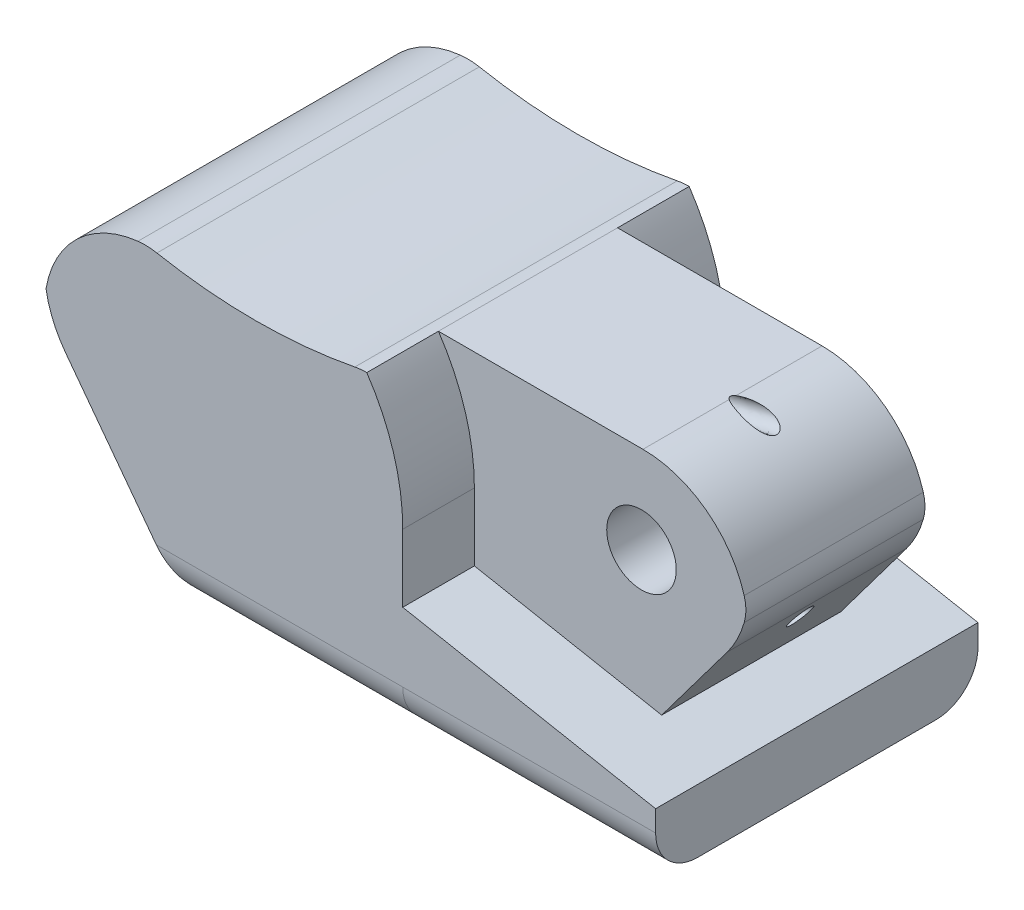
from build123d import *

# Parameters (mm, degrees)
BOSS_EXTRUDE1_DEPTH = 15.3
FILLET1_R           = 5
SKETCH3_R           = 1.6499999999999986
CUT_EXTRUDE1_DEPTH  = 27.1150700798197
SKETCH6_W           = 13.000000000000002
SKETCH6_H           = 3.3999999999999995
SKETCH6_H_2         = 3.4000000000000004
CUT_EXTRUDE4_DEPTH  = 12
CUT_EXTRUDE5_DEPTH  = 27.1150700798197
FILLET5_R           = 3
FILLET7_R           = 10
FILLET8_R           = 2
SKETCH14_W          = 39.168400235904954
SKETCH14_H          = 4.224796924987116
CUT_EXTRUDE8_DEPTH  = 27.115070253014974
FILLET10_R          = 2
BOSS_EXTRUDE2_START = -15.3
BOSS_EXTRUDE2_DEPTH = 15.3
FILLET11_R          = 2
FILLET15_R          = 2
SKETCH8_R           = 0.5000000000000026
CUT_EXTRUDE10_DEPTH = 38.472055021272986
SKETCH8_5_R         = 0.5000000000000026
CUT_EXTRUDE11_DEPTH = 37.89801687295938
SKETCH19_R          = 1.5000000000000007
CUT_EXTRUDE12_DEPTH = 4


with BuildPart() as part:
    # Sketch2 → Boss-Extrude1 (new body)
    with BuildSketch(Plane.XY):
        Polygon((-15, 0), (15, 0), (15, -5), (7.5, -15.000000000000002), (-7.5, -15.000000000000002), (-15, -5), align=None)
    extrude(amount=BOSS_EXTRUDE1_DEPTH)

    # Fillet1
    # the kernel refuses this fillet: 5 mm, written as the material it takes off along each edge
    with BuildSketch(Plane(origin=(15, 0, -12.499999999999998), x_dir=(-1, 0, 0), z_dir=(0, 0, 1))) as fillet1_piece_1:
        with BuildLine():
            CenterArc((FILLET1_R, FILLET1_R), FILLET1_R, 180, 90)
            Line((0, FILLET1_R), (0, 0))
            Line((0, 0), (FILLET1_R, 0))
        make_face()
    extrude(amount=40.3, mode=Mode.SUBTRACT)
    with BuildSketch(Plane(origin=(-15, 0, -12.499999999999998), x_dir=(1, 0, 0), z_dir=(0, 0, 1))) as fillet1_piece_2:
        with BuildLine():
            CenterArc((FILLET1_R, -FILLET1_R), FILLET1_R, 90, 90)
            Line((0, -FILLET1_R), (0, 0))
            Line((0, 0), (FILLET1_R, 0))
        make_face()
    extrude(amount=40.3, mode=Mode.SUBTRACT)
    with BuildSketch(Plane(origin=(15, -5, -4.166666666666666), x_dir=(0, 1, 0), z_dir=(0, 0, 1))) as fillet1_piece_3:
        with BuildLine():
            CenterArc((FILLET1_R * 0.333333333333, FILLET1_R), FILLET1_R, 233.13010235415598, 36.86989764584405)
            Line((-FILLET1_R * 0.266666666667, FILLET1_R * 0.2), (0, 0))
            Line((0, 0), (FILLET1_R * 0.333333333333, 0))
        make_face()
    extrude(amount=23.633333333333333, mode=Mode.SUBTRACT)
    with BuildSketch(Plane(origin=(7.5, -15.000000000000002, -6.250000000000007), x_dir=(0.6000000000000001, 0.7999999999999998, 0), z_dir=(0, 0, 1))) as fillet1_piece_4:
        with BuildLine():
            CenterArc((FILLET1_R * 0.5, FILLET1_R), FILLET1_R, 216.86989764584402, 53.13010235415601)
            Line((-FILLET1_R * 0.3, FILLET1_R * 0.4), (0, 0))
            Line((0, 0), (FILLET1_R * 0.5, 1.8e-16))
        make_face()
    extrude(amount=27.80000000000001, mode=Mode.SUBTRACT)
    with BuildSketch(Plane(origin=(-7.5, -15.000000000000002, -6.2500000000000036), x_dir=(1, 0, 0), z_dir=(0, 0, 1))) as fillet1_piece_5:
        with BuildLine():
            CenterArc((FILLET1_R * 0.5, FILLET1_R), FILLET1_R, 216.869897645844, 53.13010235415601)
            Line((-FILLET1_R * 0.3, FILLET1_R * 0.4), (0, 0))
            Line((0, 0), (FILLET1_R * 0.5, 0))
        make_face()
    extrude(amount=27.800000000000008, mode=Mode.SUBTRACT)
    with BuildSketch(Plane(origin=(-15, -5, -4.166666666666666), x_dir=(0.6000000000000004, -0.7999999999999998, 0), z_dir=(0, 0, 1))) as fillet1_piece_6:
        with BuildLine():
            CenterArc((FILLET1_R * 0.333333333333, FILLET1_R), FILLET1_R, 233.13010235415595, 36.86989764584399)
            Line((-FILLET1_R * 0.266666666667, FILLET1_R * 0.2), (0, 0))
            Line((0, 0), (FILLET1_R * 0.333333333333, -3e-17))
        make_face()
    extrude(amount=23.63333333333333, mode=Mode.SUBTRACT)

    # Sketch3 → Cut-Extrude1 (cut, through all)
    with BuildSketch(Plane.XY.offset(15.3)):
        with Locations((9.930066485916347, -4.166666666666668)):
            Circle(SKETCH3_R)
    extrude(amount=-CUT_EXTRUDE1_DEPTH, mode=Mode.SUBTRACT)

    # Sketch6 → Cut-Extrude4 (cut)
    with BuildSketch(Plane(origin=(0, 0, 0), x_dir=(1, 0, 0), z_dir=(0, 1, 0))):
        with Locations((8.5, -1.6999999999999997)):
            Rectangle(SKETCH6_W, SKETCH6_H)
        with Locations((8.5, -13.600000000000001)):
            Rectangle(SKETCH6_W, SKETCH6_H_2)
    extrude(amount=-CUT_EXTRUDE4_DEPTH, mode=Mode.SUBTRACT)

    # Sketch7 → Cut-Extrude5 (cut, through all)
    with BuildSketch(Plane(origin=(0, 0, 0), x_dir=(-1, 0, 0), z_dir=(0, 0, -1))):
        with BuildLine():
            Line((0, 0), (9.999999999999998, 0))
            ThreePointArc((9.999999999999998, 0), (5.000000000000001, -0.5051025721682194), (0, 0))
        make_face()
    extrude(amount=-CUT_EXTRUDE5_DEPTH, mode=Mode.SUBTRACT)

    # Fillet5
    fillet5_edges = [part.edges().sort_by_distance(p)[0] for p in [
        (0, 1.78e-15, 7.65),
        (-10, 0, 7.649999999999999),
    ]]
    fillet(fillet5_edges, radius=FILLET5_R)

    # Fillet7
    # the kernel refuses this fillet: 10 mm, written as the material it takes off along each edge
    with BuildSketch(Plane(origin=(2, 0, 29.264915023330374), x_dir=(-1.0, -2.233978436482516e-12, 0), z_dir=(0, 0, -1))) as fillet7_piece_1:
        with BuildLine():
            CenterArc((10.000000000012479, -5.585966009309811), FILLET7_R, 146.04120119417382, 33.95879880595419)
            Line((1.247893e-11, -5.58596600933215), (-0.19999999998752124, -5.585966009332597))
            Line((-0.19999999998752124, -5.585966009332597), (-0.20000000000000018, -4.468e-13))
            Line((-0.20000000000000018, -4.468e-13), (-4.468e-13, 0.2))
            ThreePointArc((-4.468e-13, 0.2), (0.852802640859637, 0.20000000000190515), (1.5397173873543193, 0.11171932018619622))
            Line((1.5397173873543193, 0.11171932018619622), (1.7056052817201657, 0))
        make_face()
    extrude(amount=17.364915023330376, mode=Mode.SUBTRACT)
    with BuildSketch(Plane(origin=(2, 0, 29.264915023330374), x_dir=(-1.0, -2.233978436482516e-12, 0), z_dir=(0, 0, -1))) as fillet7_piece_2_section:
        with BuildLine():
            CenterArc((10.000000000012479, -5.585966009309811), FILLET7_R, 146.04120119417382, 33.95879880595419)
            Line((1.247893e-11, -5.58596600933215), (-0.19999999998752124, -5.585966009332597))
            Line((-0.19999999998752124, -5.585966009332597), (-0.20000000000000018, -4.468e-13))
            Line((-0.20000000000000018, -4.468e-13), (-4.468e-13, 0.2))
            ThreePointArc((-4.468e-13, 0.2), (0.852802640859637, 0.20000000000190515), (1.5397173873543193, 0.11171932018619622))
            Line((1.5397173873543193, 0.11171932018619622), (1.7056052817201657, 0))
        make_face()
    fillet7_piece_2 = extrude(amount=31.32983004666075, mode=Mode.PRIVATE)
    fillet7_piece_2 = split(fillet7_piece_2, bisect_by=Plane(origin=(2, 0, 3.3999999999999986), z_dir=(0, 0, -1)), keep=Keep.TOP, mode=Mode.PRIVATE)
    add(fillet7_piece_2, mode=Mode.SUBTRACT)
    with BuildSketch(Plane(origin=(2, 0, -13.96491502333037), x_dir=(-1.0, -2.2334576955882334e-12, 0), z_dir=(0, 0, 1))) as fillet7_piece_3:
        with BuildLine():
            CenterArc((10.000000000012475, 5.585966009309815), FILLET7_R, 179.99999999987205, 33.95879880595419)
            Line((1.247602e-11, 5.585966009332149), (-0.19999999998752416, 5.585966009332596))
            Line((-0.19999999998752416, 5.585966009332596), (-0.20000000000000018, 4.4669e-13))
            Line((-0.20000000000000018, 4.4669e-13), (-4.4669e-13, -0.2))
            ThreePointArc((-4.4669e-13, -0.2), (0.8528026408596371, -0.2000000000019047), (1.5397173873543175, -0.1117193201861963))
            Line((1.5397173873543175, -0.1117193201861963), (1.705605281720164, 0))
        make_face()
    extrude(amount=17.36491502333037, mode=Mode.SUBTRACT)
    with BuildSketch(Plane(origin=(2, 0, -13.96491502333037), x_dir=(-1.0, -2.2334576955882334e-12, 0), z_dir=(0, 0, 1))) as fillet7_piece_4_section:
        with BuildLine():
            CenterArc((10.000000000012475, 5.585966009309815), FILLET7_R, 179.99999999987205, 33.95879880595419)
            Line((1.247602e-11, 5.585966009332149), (-0.19999999998752416, 5.585966009332596))
            Line((-0.19999999998752416, 5.585966009332596), (-0.20000000000000018, 4.4669e-13))
            Line((-0.20000000000000018, 4.4669e-13), (-4.4669e-13, -0.2))
            ThreePointArc((-4.4669e-13, -0.2), (0.8528026408596371, -0.2000000000019047), (1.5397173873543175, -0.1117193201861963))
            Line((1.5397173873543175, -0.1117193201861963), (1.705605281720164, 0))
        make_face()
    fillet7_piece_4 = extrude(amount=31.329830046660742, mode=Mode.PRIVATE)
    fillet7_piece_4 = split(fillet7_piece_4, bisect_by=Plane(origin=(2, 0, 11.899999999999999), z_dir=(0, 0, 1)), keep=Keep.TOP, mode=Mode.PRIVATE)
    add(fillet7_piece_4, mode=Mode.SUBTRACT)

    # Fillet8
    fillet8_edges = [part.edges().sort_by_distance(p)[0] for p in [
        (14.930066485916488, -4.1666666666675, 7.649999999999999),
    ]]
    fillet(fillet8_edges, radius=FILLET8_R)

    # Sketch14 → Cut-Extrude8 (cut, through all)
    with BuildSketch(Plane(origin=(0, 0, 0), x_dir=(-1, 0, 0), z_dir=(0, 0, -1))):
        with Locations((-3.087175127191699, -16.183809827012396)):
            Rectangle(SKETCH14_W, SKETCH14_H)
    extrude(amount=-CUT_EXTRUDE8_DEPTH, mode=Mode.SUBTRACT)

    # Fillet10
    fillet10_edges = [part.edges().sort_by_distance(p)[0] for p in [
        (0, -14.071411364518838, 0),
        (0, -14.071411364518838, 15.3),
    ]]
    fillet(fillet10_edges, radius=FILLET10_R)

    # Sketch15 → Boss-Extrude2 (add)
    with BuildSketch(Plane(origin=(0, 0, 0), x_dir=(-1, 0, 0), z_dir=(0, 0, -1)).offset(BOSS_EXTRUDE2_START)):
        Polygon((-14.000000000000002, -11.071411364518834), (-2, -8.79298300465997), (-2, -14.071411364518838), (-14.000000000000002, -14.071411364518836), align=None)
    extrude(amount=BOSS_EXTRUDE2_DEPTH)

    # Fillet11
    fillet11_edges = [part.edges().sort_by_distance(p)[0] for p in [
        (8, -14.071411364518838, 0),
    ]]
    fillet(fillet11_edges, radius=FILLET11_R)

    # Fillet15
    fillet15_edges = [part.edges().sort_by_distance(p)[0] for p in [
        (8, -14.071411364518838, 15.3),
    ]]
    fillet(fillet15_edges, radius=FILLET15_R)

    # Sketch8 → Cut-Extrude10 (cut, through all, along a direction that is not the sketch's normal)
    with BuildSketch(Plane.ZY.offset(15)):
        with Locations((7.65, -6.500000000000001)):
            Circle(SKETCH8_R)
    extrude(amount=-CUT_EXTRUDE10_DEPTH, dir=(-0.9721573012761343, -0.23432921622261157, 0), mode=Mode.SUBTRACT)

    # Sketch8<5> → Cut-Extrude11 (cut, through all, along a direction that is not the sketch's normal)
    with BuildSketch(Plane.ZY.offset(15)):
        with Locations((7.65, -12)):
            Circle(SKETCH8_5_R)
    extrude(amount=-CUT_EXTRUDE11_DEPTH, dir=(-0.9868824880574057, -0.1614402513799591, 0), mode=Mode.SUBTRACT)

    # Sketch19 → Cut-Extrude12 (cut, along a direction that is not the sketch's normal)
    with BuildSketch(Plane(origin=(-12.000000000000007, -9.000000000000004, 0), x_dir=(0, 0, 1), z_dir=(-0.8, -0.6000000000000001, 0))):
        with Locations((7.649999999999997, 0.12042260901835285)):
            Circle(SKETCH19_R)
    extrude(amount=-CUT_EXTRUDE12_DEPTH, dir=(-1, 0, 0), mode=Mode.SUBTRACT)


solid = part.part
